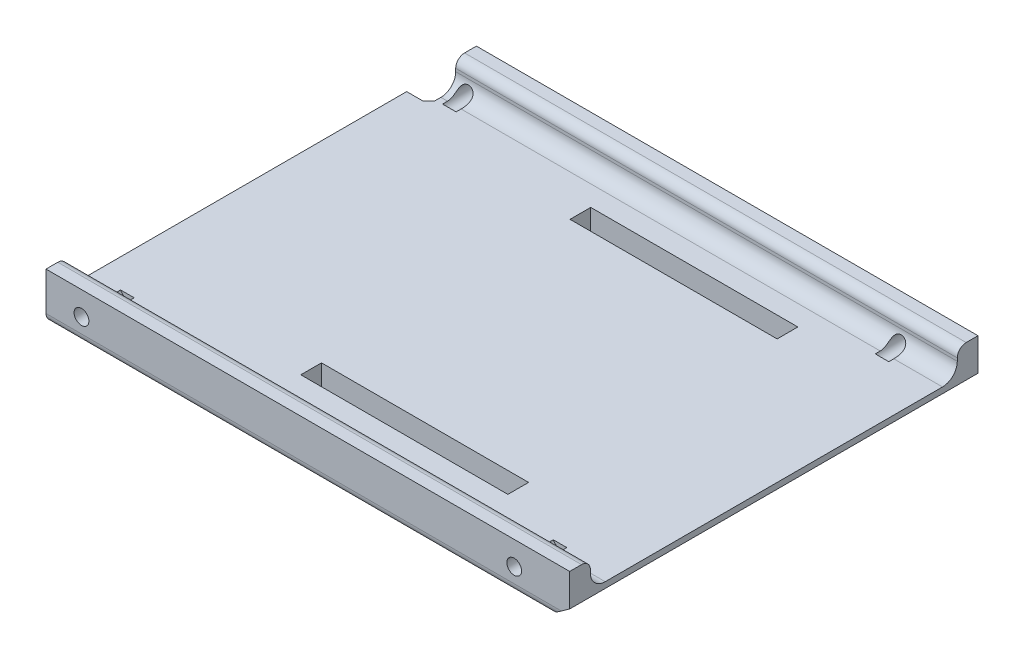
from build123d import *

# Parameters (mm, degrees)
SKETCH2_R           = 1.25
BOSS_EXTRUDE1_DEPTH = 69
SKETCH3_W           = 62
SKETCH3_H           = 4.5
CUT_EXTRUDE1_DEPTH  = 113.504444357
SKETCH4_W           = 54.406446317
SKETCH4_H           = 2.417375431
BOSS_EXTRUDE2_DEPTH = 83
FILLET1_R           = 1.5
FILLET2_R           = 2.5
FILLET3_R           = 1.5
CUT_EXTRUDE3_DEPTH  = 113.504444497
CUT_EXTRUDE5_REACH  = 114.504
SKETCH7_W           = 35
SKETCH7_H           = 3.5


with BuildPart() as part:
    # Sketch2 → Boss-Extrude1 (new body)
    with BuildSketch(Plane.XY):
        Polygon((0, 0), (0, 8), (88.5, 8), (88.5, 2.5), (85, 0), align=None)
        with Locations((6.000001876, 4)):
            Circle(SKETCH2_R, mode=Mode.SUBTRACT)
        with Locations((79.120881892, 4)):
            Circle(SKETCH2_R, mode=Mode.SUBTRACT)
    extrude(amount=BOSS_EXTRUDE1_DEPTH)

    # Sketch3 → Cut-Extrude1 (cut, through all)
    with BuildSketch(Plane.ZY):
        with Locations((34.5, 5.75)):
            Rectangle(SKETCH3_W, SKETCH3_H)
    extrude(amount=-CUT_EXTRUDE1_DEPTH, mode=Mode.SUBTRACT)

    # Sketch4 → Boss-Extrude2 (add)
    with BuildSketch(Plane.ZY):
        with Locations((34.04742318, 2.291312285)):
            Rectangle(SKETCH4_W, SKETCH4_H)
    extrude(amount=-BOSS_EXTRUDE2_DEPTH)

    # Fillet1
    fillet1_edges = [part.edges().sort_by_distance(p)[0] for p in [
        (42.5, 0, 69),
        (42.5, 0, 0),
    ]]
    fillet(fillet1_edges, radius=FILLET1_R)

    # Fillet2
    # the kernel refuses this fillet: 2.5 mm, written as the material it adds along each edge
    with BuildSketch(Plane(origin=(0, 3.5, 65.5), x_dir=(0, 0, -1), z_dir=(1, 0, 0))) as fillet2_piece_1_section:
        with BuildLine():
            CenterArc((FILLET2_R, FILLET2_R), FILLET2_R, 180, 90)
            Line((0, FILLET2_R), (0, 0))
            Line((0, 0), (FILLET2_R, 0))
        make_face()
    fillet2_piece_1 = extrude(amount=11.104357952, mode=Mode.PRIVATE)
    fillet2_piece_1 = fillet2_piece_1 - Plane(origin=(6.000001876, 4, 63.653309705), x_dir=(1, 0, 0), z_dir=(0, 0, -1)) * Cylinder(1.25, 33, mode=Mode.PRIVATE)
    add(fillet2_piece_1)
    with BuildSketch(Plane(origin=(0.8956458, 3.5, 65.5), x_dir=(0, 0, -1), z_dir=(1, 0, 0))) as fillet2_piece_2_section:
        with BuildLine():
            CenterArc((FILLET2_R, FILLET2_R), FILLET2_R, 180, 90)
            Line((0, FILLET2_R), (0, 0))
            Line((0, 0), (FILLET2_R, 0))
        make_face()
    fillet2_piece_2 = extrude(amount=83.329592169, mode=Mode.PRIVATE)
    fillet2_piece_2 = fillet2_piece_2 - Plane(origin=(6.000001876, 4, 64.936218349), x_dir=(1, 0, 0), z_dir=(0, 0, -1)) * Cylinder(1.25, 177, mode=Mode.PRIVATE)
    fillet2_piece_2 = fillet2_piece_2 - Plane(origin=(79.120881892, 4, 64.936218349), x_dir=(1, 0, 0), z_dir=(0, 0, -1)) * Cylinder(1.25, 177, mode=Mode.PRIVATE)
    add(fillet2_piece_2)
    with BuildSketch(Plane(origin=(0, 3.5, 3.5), x_dir=(0, 1, 0), z_dir=(1, 0, 0))) as fillet2_piece_3_section:
        with BuildLine():
            CenterArc((FILLET2_R, FILLET2_R), FILLET2_R, 180, 90)
            Line((0, FILLET2_R), (0, 0))
            Line((0, 0), (FILLET2_R, 0))
        make_face()
    fillet2_piece_3 = extrude(amount=11.104357952, mode=Mode.PRIVATE)
    fillet2_piece_3 = fillet2_piece_3 - Plane(origin=(6.000001876, 4, 3.561814983), x_dir=(1, 0, 0), z_dir=(0, 0, -1)) * Cylinder(1.25, 33, mode=Mode.PRIVATE)
    add(fillet2_piece_3)
    with BuildSketch(Plane(origin=(74.016525816, 3.5, 3.5), x_dir=(0, 1, 0), z_dir=(1, 0, 0))) as fillet2_piece_4_section:
        with BuildLine():
            CenterArc((FILLET2_R, FILLET2_R), FILLET2_R, 180, 90)
            Line((0, FILLET2_R), (0, 0))
            Line((0, 0), (FILLET2_R, 0))
        make_face()
    fillet2_piece_4 = extrude(amount=14.483474184, mode=Mode.PRIVATE)
    fillet2_piece_4 = fillet2_piece_4 - Plane(origin=(79.120881892, 4, 4.058892955), x_dir=(1, 0, 0), z_dir=(0, 0, -1)) * Cylinder(1.25, 39, mode=Mode.PRIVATE)
    add(fillet2_piece_4)
    with BuildSketch(Plane(origin=(0.8956458, 3.5, 3.5), x_dir=(0, 1, 0), z_dir=(1, 0, 0))) as fillet2_piece_5_section:
        with BuildLine():
            CenterArc((FILLET2_R, FILLET2_R), FILLET2_R, 180, 90)
            Line((0, FILLET2_R), (0, 0))
            Line((0, 0), (FILLET2_R, 0))
        make_face()
    fillet2_piece_5 = extrude(amount=83.329592169, mode=Mode.PRIVATE)
    fillet2_piece_5 = fillet2_piece_5 - Plane(origin=(79.120881892, 4, 4.063781674), x_dir=(1, 0, 0), z_dir=(0, 0, -1)) * Cylinder(1.25, 177, mode=Mode.PRIVATE)
    fillet2_piece_5 = fillet2_piece_5 - Plane(origin=(6.000001876, 4, 4.063781674), x_dir=(1, 0, 0), z_dir=(0, 0, -1)) * Cylinder(1.25, 177, mode=Mode.PRIVATE)
    add(fillet2_piece_5)
    with BuildSketch(Plane(origin=(74.016525816, 3.5, 65.5), x_dir=(0, 0, -1), z_dir=(1, 0, 0))) as fillet2_piece_6_section:
        with BuildLine():
            CenterArc((FILLET2_R, FILLET2_R), FILLET2_R, 180, 90)
            Line((0, FILLET2_R), (0, 0))
            Line((0, 0), (FILLET2_R, 0))
        make_face()
    fillet2_piece_6 = extrude(amount=14.483474184, mode=Mode.PRIVATE)
    fillet2_piece_6 = fillet2_piece_6 - Plane(origin=(79.120881892, 4, 64.941107203), x_dir=(1, 0, 0), z_dir=(0, 0, -1)) * Cylinder(1.25, 39, mode=Mode.PRIVATE)
    add(fillet2_piece_6)

    # Fillet3
    fillet3_edges = [part.edges().sort_by_distance(p)[0] for p in [
        (44.25, 8, 3.5),
        (44.25, 8, 65.5),
    ]]
    fillet(fillet3_edges, radius=FILLET3_R)

    # Sketch6 → Cut-Extrude3 (cut, through all)
    with BuildSketch(Plane.XZ):
        Polygon((-1.398299913, 8.05064563), (2.800616001, 8.05064563), (3.736645897, 7.027940595), (3.736645897, 1.098360778), (3.736645897, 0), (-1.236121559, -1.139461127), align=None)
    extrude(amount=-CUT_EXTRUDE3_DEPTH, mode=Mode.SUBTRACT)

    # Sketch7 → Cut-Extrude5 (cut, up to next)
    with BuildSketch(Plane.XZ, mode=Mode.PRIVATE) as cut_extrude5_sk1:
        with Locations((50, 56.69585569)):
            Rectangle(SKETCH7_W, SKETCH7_H)
    cut_extrude5_tool1 = extrude(cut_extrude5_sk1.sketch, amount=-CUT_EXTRUDE5_REACH, mode=Mode.PRIVATE) & part.part
    # Sketch7 → Cut-Extrude5 (cut, up to next)
    with BuildSketch(Plane.XZ, mode=Mode.PRIVATE) as cut_extrude5_sk2:
        with Locations((50, 11.19585569)):
            Rectangle(SKETCH7_W, SKETCH7_H)
    cut_extrude5_tool2 = extrude(cut_extrude5_sk2.sketch, amount=-CUT_EXTRUDE5_REACH, mode=Mode.PRIVATE) & part.part
    add(cut_extrude5_tool1.solids().sort_by_distance((50, 0, 56.695856))[0], mode=Mode.SUBTRACT)
    add(cut_extrude5_tool2.solids().sort_by_distance((50, 0, 11.195856))[0], mode=Mode.SUBTRACT)


solid = part.part
